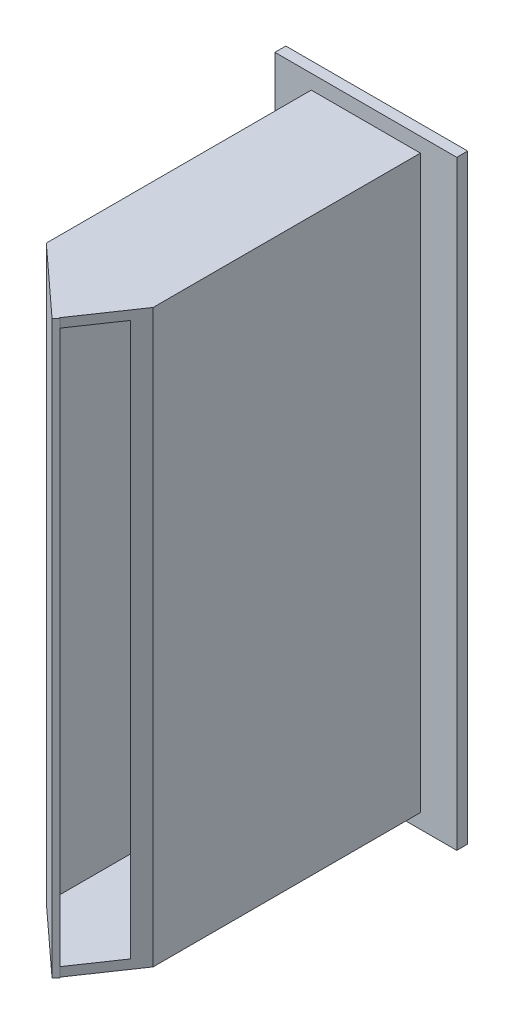
from build123d import *

# Parameters (mm, degrees)
SKETCH_1_W          = 10
SKETCH_1_H          = 33
SKETCH_1_W_2        = 5
SKETCH_1_H_2        = 30.4
EXTRUDE_1_DEPTH     = 0.6
SKETCH_2_W          = 6
SKETCH_2_H          = 31.4
SKETCH_2_W_2        = 5
SKETCH_2_H_2        = 30.4
EXTRUDE_2_DEPTH     = 18
CUT_EXTRUDE_1_DEPTH = 39.507142195
SKETCH_6_W          = 5.08408563
SKETCH_6_H          = 31.4
EXTRUDE_5_DEPTH     = 0.3


with BuildPart() as part:
    # 草图1 → 凸台-拉伸1 (new body)
    with BuildSketch(Plane.XY):
        with Locations((5, 16.5)):
            Rectangle(SKETCH_1_W, SKETCH_1_H)
        with Locations((5, 16.5)):
            Rectangle(SKETCH_1_W_2, SKETCH_1_H_2, mode=Mode.SUBTRACT)
    extrude(amount=EXTRUDE_1_DEPTH)

    # 草图2 → 凸台-拉伸2 (add)
    with BuildSketch(Plane.XY.offset(0.6)):
        with Locations((5, 16.5)):
            Rectangle(SKETCH_2_W, SKETCH_2_H)
        with Locations((5, 16.5)):
            Rectangle(SKETCH_2_W_2, SKETCH_2_H_2, mode=Mode.SUBTRACT)
    extrude(amount=EXTRUDE_2_DEPTH)

    # 草图5 → 切除-拉伸1 (cut, through all)
    with BuildSketch(Plane(origin=(0, 32.2, 0), x_dir=(1, 0, 0), z_dir=(0, 1, 0))):
        Polygon((2, -15.165872509), (5.748959197, -18.6), (8, -15.293519197), (8, -19.376577353), (2, -19.376577353), align=None)
    extrude(amount=-CUT_EXTRUDE_1_DEPTH, mode=Mode.SUBTRACT)

    # 草图6 → 凸台-拉伸5 (add)
    with BuildSketch(Plane(origin=(-6.641349077, 0, 7.250210357), x_dir=(0.7373910414638508, 0, 0.6754660997924747), z_dir=(-0.6754660997924747, 0, 0.7373910414638508))):
        with Locations((14.260857651, 16.5)):
            Rectangle(SKETCH_6_W, SKETCH_6_H)
    extrude(amount=-EXTRUDE_5_DEPTH)


solid = part.part
